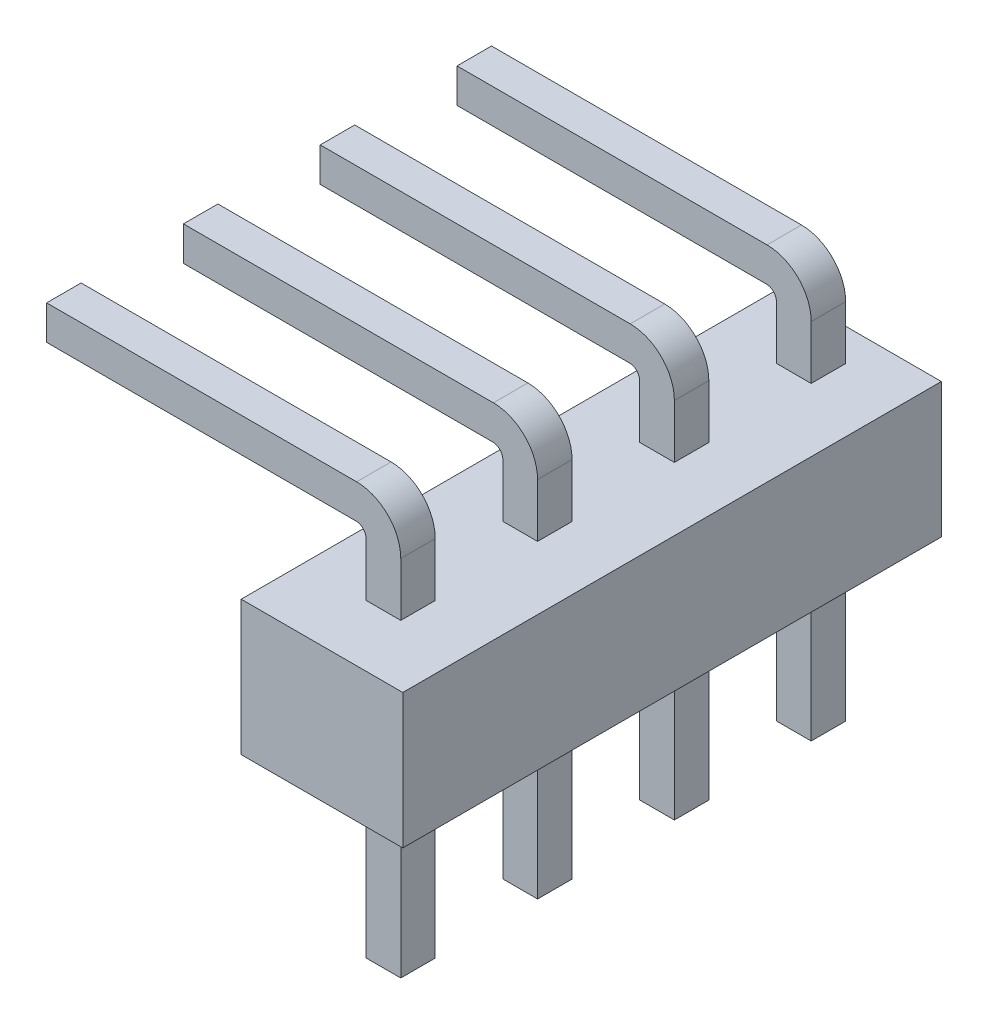
from build123d import *

# Parameters (mm, degrees)
SKETCH1_W       = 3
SKETCH1_H       = 2.5
EXTRUDE1_DEPTH  = 5
SKETCH2_W       = 0.645
SKETCH2_H       = 3.5
EXTRUDE2_DEPTH  = 0.64
LPATTERN1_COUNT = 4
LPATTERN1_PITCH = 2.54
CHAMFER1_SIZE   = 0.25


with BuildPart() as part:
    # Sketch1 → Extrude1 (new, symmetric)
    with BuildSketch(Plane.XY):
        Rectangle(SKETCH1_W, SKETCH1_H)
    extrude(amount=EXTRUDE1_DEPTH, both=True)

    # Sketch2 → Extrude2 (add)
    with BuildSketch(Plane.XY.offset(3.86)):
        with BuildLine():
            Line((-0.3225, 1.25), (-0.3225, 2.245))
            ThreePointArc((-0.3225, 2.245), (-0.374776878, 2.375), (-0.5025, 2.43261663))
            Line((-0.5025, 2.43261663), (-6.5025, 2.43261663))
            Line((-6.5025, 2.43261663), (-6.5025, 3.06831282))
            Line((-6.5025, 3.06831282), (-0.4975, 3.06831282))
            ThreePointArc((-0.4975, 3.06831282), (0.082527742, 2.826), (0.3225, 2.245))
            Line((0.3225, 2.245), (0.3225, 1.25))
            Line((0.3225, 1.25), (-0.3225, 1.25))
        make_face()
        with Locations((0, -3)):
            Rectangle(SKETCH2_W, SKETCH2_H)
    extrude2 = extrude(amount=-EXTRUDE2_DEPTH)

    # LPattern1: Extrude2 ×4
    with Locations(*[(0, 0, -i * LPATTERN1_PITCH) for i in range(1, LPATTERN1_COUNT)]):
        add(extrude2)

    # Chamfer1
    chamfer1_edges = [part.edges().sort_by_distance(p)[0] for p in [
        (-6.5025, 2.43261663, 1),
        (-6.5025, 2.750464725, 0.68),
        (-6.5025, 3.06831282, 1),
        (-6.5025, 2.750464725, 1.32),
        (0.3225, -4.75, 3.54),
        (0, -4.75, 3.22),
        (-0.3225, -4.75, 3.54),
        (0, -4.75, 3.86),
        (0.3225, -4.75, -1.54),
        (0, -4.75, -1.86),
        (-0.3225, -4.75, -1.54),
        (0, -4.75, -1.22),
        (0.3225, -4.75, 1),
        (0, -4.75, 0.68),
        (-0.3225, -4.75, 1),
        (0, -4.75, 1.32),
        (-6.5025, 2.43261663, 3.54),
        (-6.5025, 2.750464725, 3.22),
        (-6.5025, 3.06831282, 3.54),
        (-6.5025, 2.750464725, 3.86),
        (-6.5025, 2.43261663, -1.54),
        (-6.5025, 2.750464725, -1.86),
        (-6.5025, 3.06831282, -1.54),
        (-6.5025, 2.750464725, -1.22),
        (-6.5025, 2.43261663, -4.08),
        (-6.5025, 2.750464725, -4.4),
        (-6.5025, 3.06831282, -4.08),
        (-6.5025, 2.750464725, -3.76),
        (0.3225, -4.75, -4.08),
        (0, -4.75, -4.4),
        (-0.3225, -4.75, -4.08),
        (0, -4.75, -3.76),
    ]]
    chamfer(chamfer1_edges, length=CHAMFER1_SIZE)


solid = part.part
